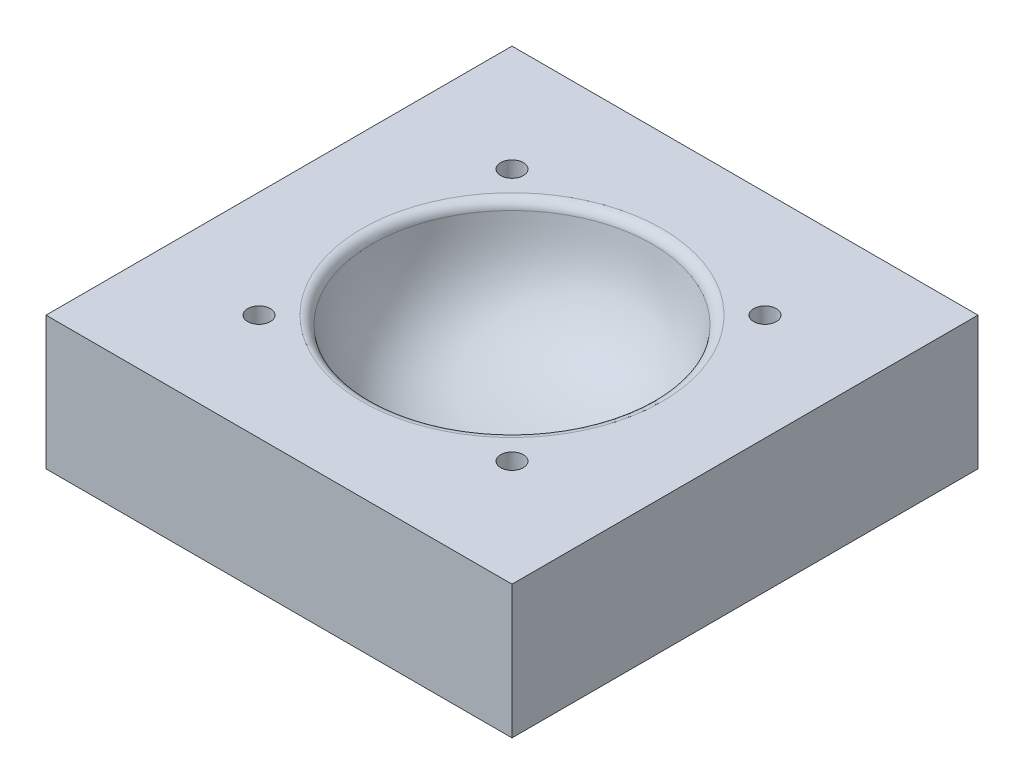
from build123d import *

# Parameters (mm, degrees)
SKETCH2_W           = 70
SKETCH2_H           = 70
BOSS_EXTRUDE1_DEPTH = 20
FILLET1_R           = 1.5
SKETCH3_R           = 1.7
CUT_EXTRUDE1_DEPTH  = 54.385391391


with BuildPart() as part:
    # Sketch2 → Boss-Extrude1 (new body)
    with BuildSketch(Plane(origin=(0, 0, 0), x_dir=(1, 0, 0), z_dir=(0, 1, 0))):
        Rectangle(SKETCH2_W, SKETCH2_H)
    extrude(amount=-BOSS_EXTRUDE1_DEPTH)

    # Sketch1 → Cut-Revolve1 (revolve, cut)
    with BuildSketch(Plane.XY):
        with BuildLine():
            Line((0, -17.2), (0, 0))
            Line((0, 0), (21.241684944, 0))
            Line((21.241684944, 0), (21.158851084, -0.511526958))
            add(Edge.make_bspline(
                [(0, -17.2), (0.530678283, -17.2), (1.61157482, -17.183508716), (3.615531125, -17.08588663), (5.944127269, -16.844919371), (8.44843367, -16.370131279), (11.442656399, -15.492934033), (14.579654851, -13.93724298), (17.382164488, -11.402739011), (19.199009229, -8.500896664), (20.23569058, -5.583194157), (20.706490619, -3.313387562), (20.981886079, -1.635929169), (21.096876841, -0.894238762), (21.158851084, -0.511526958)],
                knots=[0, 0, 0, 0, 0.03125, 0.0625, 0.125, 0.1875, 0.25, 0.375, 0.5, 0.625, 0.75, 0.875, 0.9375, 1, 1, 1, 1], degree=3))
        make_face()
    revolve(axis=Axis((0, -17.2, 0), (0, 1, 0)), mode=Mode.SUBTRACT)

    # Fillet1
    fillet1_edges = [part.edges().sort_by_distance(p)[0] for p in [
        (-21.241684944, 0, 0),
    ]]
    fillet(fillet1_edges, radius=FILLET1_R)

    # Sketch3 → Cut-Extrude1 (cut, through all)
    with BuildSketch(Plane(origin=(0, 0, 0), x_dir=(1, 0, 0), z_dir=(0, 1, 0))):
        with Locations((-19, 19)):
            Circle(SKETCH3_R)
        with Locations((19, -19)):
            Circle(SKETCH3_R)
        with Locations((-19, -19)):
            Circle(SKETCH3_R)
        with Locations((19, 19)):
            Circle(SKETCH3_R)
    extrude(amount=-CUT_EXTRUDE1_DEPTH, mode=Mode.SUBTRACT)


solid = part.part
